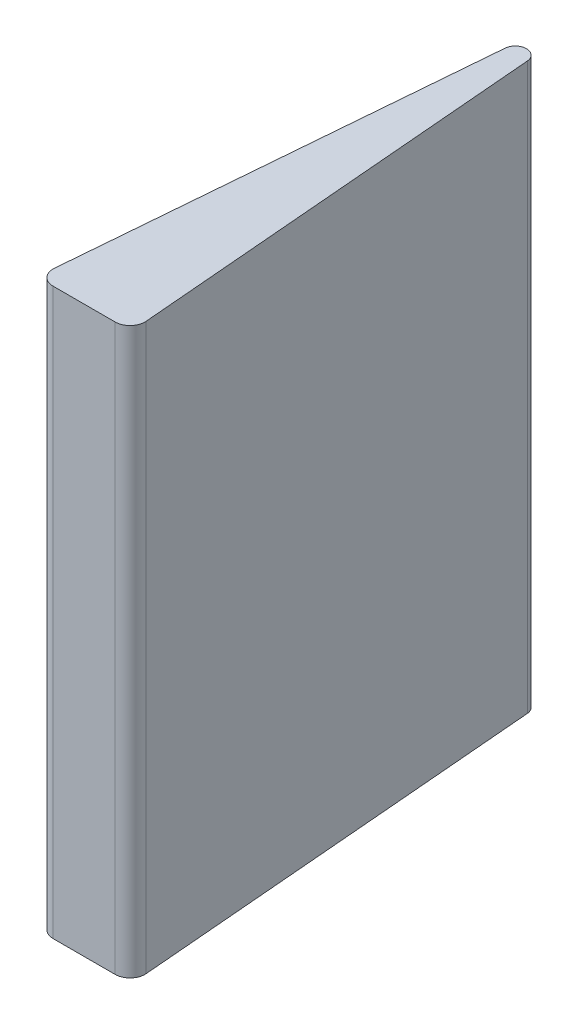
from build123d import *

# Parameters (mm, degrees)
BOSS_EXTRUDE1_DEPTH      = 380
BOSS_EXTRUDE1_DEPTH_BACK = 380


with BuildPart() as part:
    # Sketch1 → Boss-Extrude1 (new, two sides: drawn at the far end of the back side and taken through both)
    with BuildSketch(Plane(origin=(0, 0, 0), x_dir=(1, 0, 0), z_dir=(0, 1, 0)).offset(-BOSS_EXTRUDE1_DEPTH_BACK)):
        with BuildLine():
            Line((-61.712368752, -98.334403464), (-14.947893024, 461.249197402))
            ThreePointArc((-14.947893024, 461.249197402), (0, 475), (14.947893024, 461.249197402))
            Line((14.947893024, 461.249197402), (61.712368752, -98.334403464))
            ThreePointArc((61.712368752, -98.334403464), (56.501082654, -113.540459174), (41.78184472, -120))
            Line((41.78184472, -120), (-41.78184472, -120))
            ThreePointArc((-41.78184472, -120), (-56.501082654, -113.540459174), (-61.712368752, -98.334403464))
        make_face()
    extrude(amount=BOSS_EXTRUDE1_DEPTH + BOSS_EXTRUDE1_DEPTH_BACK)


solid = part.part
